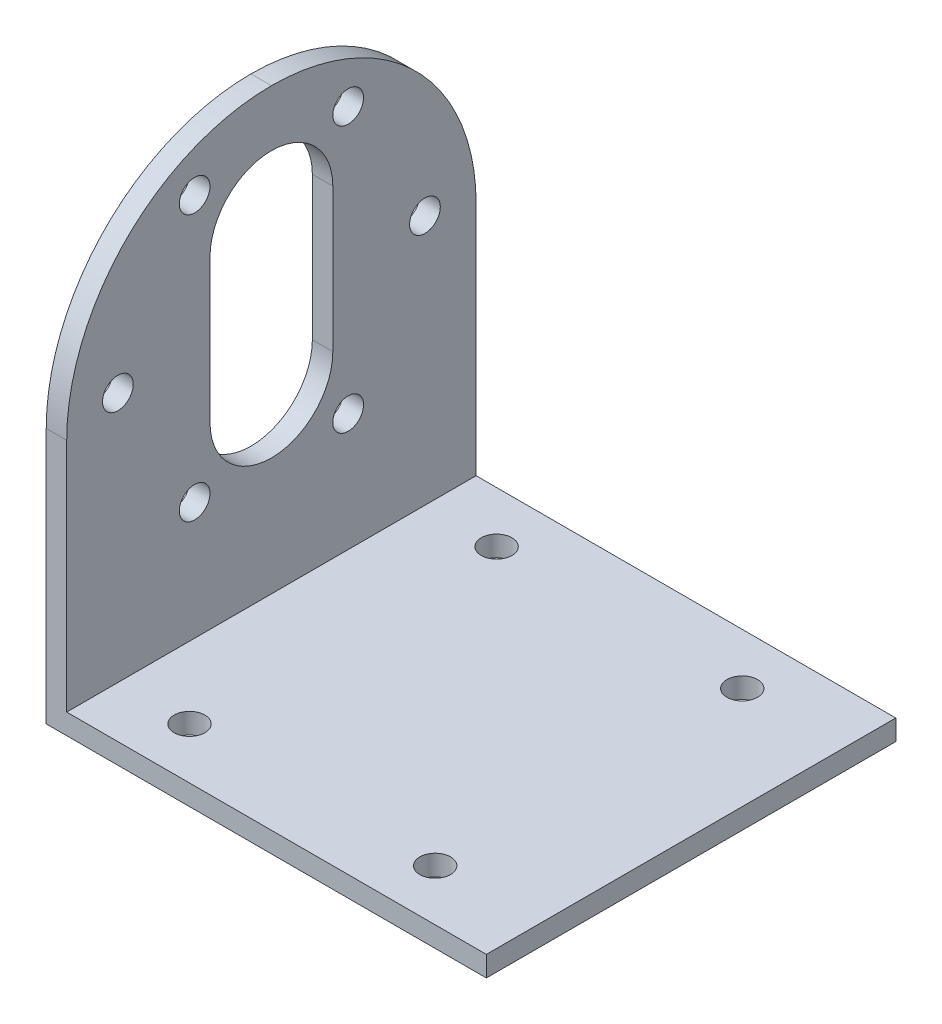
from build123d import *

# Parameters (mm, degrees)
EXTRUDE_1_DEPTH     = 40
SKETCH_2_R          = 1.5
CUT_EXTRUDE_1_DEPTH = 73.78736154
FILLET_1_R          = 20
CUT_EXTRUDE_2_DEPTH = 73.78736154
SKETCH_4_R          = 1.5
CUT_EXTRUDE_3_DEPTH = 72.624018318


with BuildPart() as part:
    # 草图1 → 拉伸-薄壁1 (new body)
    with BuildSketch(Plane.XY):
        Polygon((41, 0), (0, 0), (0, 43), (-2, 43), (-2, -2), (41, -2), align=None)
    extrude(amount=EXTRUDE_1_DEPTH)

    # 草图2 → 切除-拉伸1 (cut, through all)
    with BuildSketch(Plane.ZY.offset(2)):
        with Locations((35, 24.5)):
            Circle(SKETCH_2_R)
        with Locations((27.5, 11.509618943)):
            Circle(SKETCH_2_R)
        with Locations((12.5, 11.509618943)):
            Circle(SKETCH_2_R)
        with Locations((5, 24.5)):
            Circle(SKETCH_2_R)
        with Locations((12.5, 37.490381057)):
            Circle(SKETCH_2_R)
        with Locations((27.5, 37.490381057)):
            Circle(SKETCH_2_R)
    extrude(amount=-CUT_EXTRUDE_1_DEPTH, mode=Mode.SUBTRACT)

    # 圆角1
    fillet_1_edges = [part.edges().sort_by_distance(p)[0] for p in [
        (-1, 43, 40),
        (-1, 43, 0),
    ]]
    fillet(fillet_1_edges, radius=FILLET_1_R - 0.0001)  # a hair under: the kernel refuses the full size

    # 草图3 → 切除-拉伸2 (cut, through all)
    with BuildSketch(Plane.ZY.offset(2)):
        with BuildLine():
            Line((26, 31.5), (26, 17.5))
            ThreePointArc((26, 17.5), (20, 11.5), (14, 17.5))
            Line((14, 17.5), (14, 31.5))
            ThreePointArc((14, 31.5), (20, 37.5), (26, 31.5))
        make_face()
    extrude(amount=-CUT_EXTRUDE_2_DEPTH, mode=Mode.SUBTRACT)

    # 草图4 → 切除-拉伸3 (cut, through all)
    with BuildSketch(Plane(origin=(0, 0, 0), x_dir=(1, 0, 0), z_dir=(0, 1, 0))):
        with Locations(Location((7, -35, 0), (0, 0, 270))):
            Circle(SKETCH_4_R)
        with Locations(Location((31, -35, 0), (0, 0, 270))):
            Circle(SKETCH_4_R)
        with Locations(Location((31, -5, 0), (0, 0, 270))):
            Circle(SKETCH_4_R)
        with Locations(Location((7, -5, 0), (0, 0, 270))):
            Circle(SKETCH_4_R)
    extrude(amount=-CUT_EXTRUDE_3_DEPTH, mode=Mode.SUBTRACT)


solid = part.part
